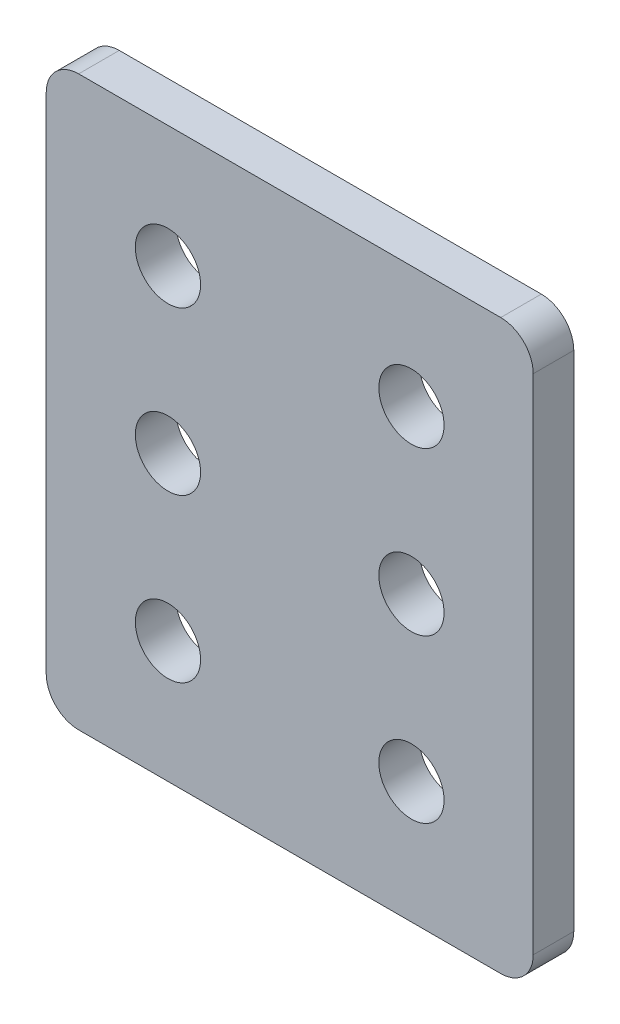
from build123d import *

# Parameters (mm, degrees)
SKETCH1_W           = 38.1
SKETCH1_H           = 44.45
SKETCH1_R           = 2.5527
BOSS_EXTRUDE1_DEPTH = 3.175
FILLET1_R           = 2.54


with BuildPart() as part:
    # Sketch1 → Boss-Extrude1 (new body)
    with BuildSketch(Plane.XY):
        Rectangle(SKETCH1_W, SKETCH1_H)
        with Locations((-9.525, -12.7)):
            Circle(SKETCH1_R, mode=Mode.SUBTRACT)
        with Locations((-9.525, 0)):
            Circle(SKETCH1_R, mode=Mode.SUBTRACT)
        with Locations((-9.525, 12.7)):
            Circle(SKETCH1_R, mode=Mode.SUBTRACT)
        with Locations((9.525, -12.7)):
            Circle(SKETCH1_R, mode=Mode.SUBTRACT)
        with Locations((9.525, 0)):
            Circle(SKETCH1_R, mode=Mode.SUBTRACT)
        with Locations((9.525, 12.7)):
            Circle(SKETCH1_R, mode=Mode.SUBTRACT)
    extrude(amount=BOSS_EXTRUDE1_DEPTH)

    # Fillet1
    fillet1_edges = [part.edges().sort_by_distance(p)[0] for p in [
        (-19.05, 22.225, 1.5875),
        (-19.05, -22.225, 1.5875),
        (19.05, -22.225, 1.5875),
        (19.05, 22.225, 1.5875),
    ]]
    fillet(fillet1_edges, radius=FILLET1_R)


solid = part.part
